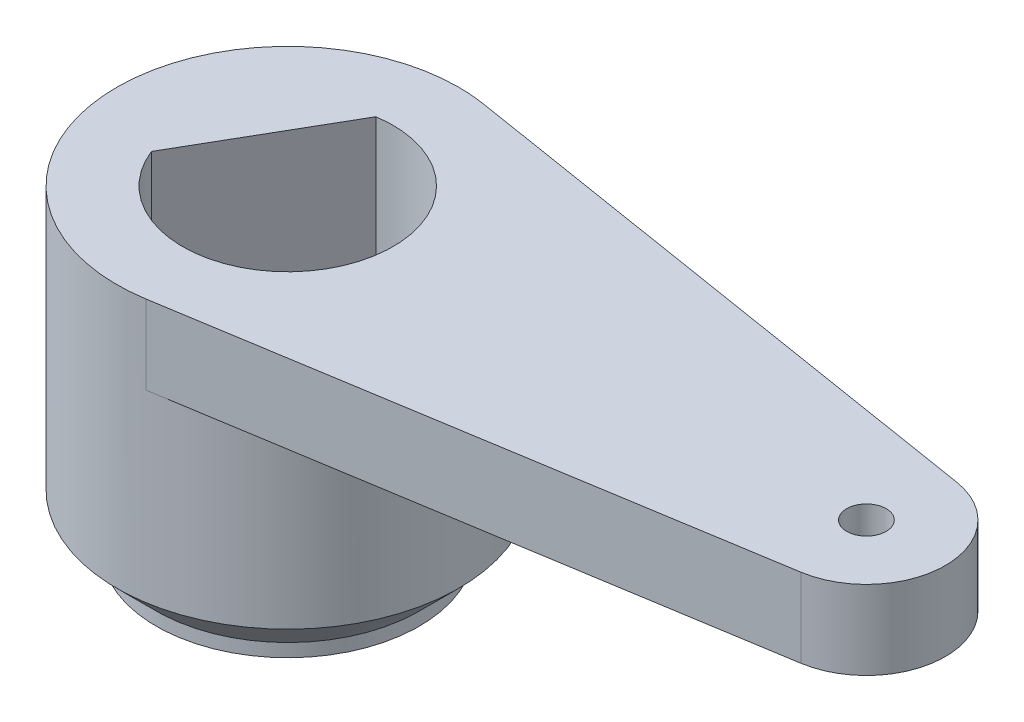
from build123d import *

# Parameters (mm, degrees)
SKETCH1_R           = 6.5
SKETCH1_R_2         = 4
BOSS_EXTRUDE1_DEPTH = 12
BOSS_EXTRUDE2_START = -3
SKETCH2_R           = 0.75
BOSS_EXTRUDE2_DEPTH = 3
SKETCH4_R           = 6.5
SKETCH4_R_2         = 5
CUT_EXTRUDE1_DEPTH  = 2
BOSS_EXTRUDE4_START = -10
BOSS_EXTRUDE4_DEPTH = 10
CHAMFER1_SIZE       = 1.5


with BuildPart() as part:
    # Sketch1 → Boss-Extrude1 (new body)
    with BuildSketch(Plane(origin=(0, 0, 0), x_dir=(1, 0, 0), z_dir=(0, 1, 0))):
        with Locations(Location((0, 0, 0), (0, 0, 270))):
            Circle(SKETCH1_R)
        with Locations(Location((0, 0, 0), (0, 0, 270))):
            Circle(SKETCH1_R_2, mode=Mode.SUBTRACT)
    extrude(amount=BOSS_EXTRUDE1_DEPTH)

    # Sketch2 → Boss-Extrude2 (add)
    with BuildSketch(Plane(origin=(0, 12, 0), x_dir=(1, 0, 0), z_dir=(0, 1, 0)).offset(BOSS_EXTRUDE2_START)):
        with BuildLine():
            Line((22.477272727, 2.961791813), (1.034090909, 6.417215595))
            ThreePointArc((1.034090909, 6.417215595), (4.948312384, 4.214760319), (6.5, 0))
            ThreePointArc((6.5, 0), (4.948312384, -4.214760319), (1.034090909, -6.417215595))
            Line((1.034090909, -6.417215595), (22.477272727, -2.961791813))
            ThreePointArc((22.477272727, -2.961791813), (25, 0), (22.477272727, 2.961791813))
        make_face()
        with Locations(Location((22, 0, 0), (0, 0, 270))):
            Circle(SKETCH2_R, mode=Mode.SUBTRACT)
    extrude(amount=BOSS_EXTRUDE2_DEPTH)

    # Sketch4 → Cut-Extrude1 (cut)
    with BuildSketch(Plane.XZ):
        with Locations(Location((0, 0, 0), (0, 0, 270))):
            Circle(SKETCH4_R)
        with Locations(Location((0, 0, 0), (0, 0, 270))):
            Circle(SKETCH4_R_2, mode=Mode.SUBTRACT)
    extrude(amount=-CUT_EXTRUDE1_DEPTH, mode=Mode.SUBTRACT)

    # Sketch5 → Boss-Extrude4 (add)
    with BuildSketch(Plane(origin=(0, 12, 0), x_dir=(1, 0, 0), z_dir=(0, 1, 0)).offset(BOSS_EXTRUDE4_START)):
        with BuildLine():
            Line((-3.726313009, -1.454163457), (-0.60381401, 3.954163457))
            ThreePointArc((-0.60381401, 3.954163457), (-3.464101615, 2), (-3.726313009, -1.454163457))
        make_face()
    extrude(amount=BOSS_EXTRUDE4_DEPTH)

    # Chamfer1
    chamfer1_edges = [part.edges().sort_by_distance(p)[0] for p in [
        (0, 2, 5),
    ]]
    chamfer(chamfer1_edges, length=CHAMFER1_SIZE - 0.0001)  # a hair under: the kernel refuses the full size


solid = part.part
